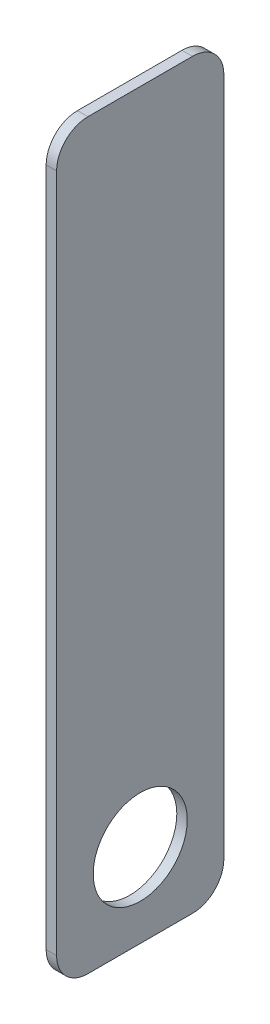
from build123d import *

# Parameters (mm, degrees)
SKETCH1_W           = 50.8
SKETCH1_H           = 225.425
SKETCH1_R           = 14.2875
BOSS_EXTRUDE1_DEPTH = 3.175
FILLET1_R           = 9.525


with BuildPart() as part:
    # Sketch1 → Boss-Extrude1 (new body)
    with BuildSketch(Plane(origin=(0, 0, 0), x_dir=(0, 0, -1), z_dir=(1, 0, 0))):
        Rectangle(SKETCH1_W, SKETCH1_H)
        with Locations((0, -87.3125)):
            Circle(SKETCH1_R, mode=Mode.SUBTRACT)
    extrude(amount=BOSS_EXTRUDE1_DEPTH)

    # Fillet1
    fillet1_edges = [part.edges().sort_by_distance(p)[0] for p in [
        (1.5875, -112.7125, -25.4),
        (1.5875, -112.7125, 25.4),
        (1.5875, 112.7125, -25.4),
        (1.5875, 112.7125, 25.4),
    ]]
    fillet(fillet1_edges, radius=FILLET1_R)


solid = part.part
